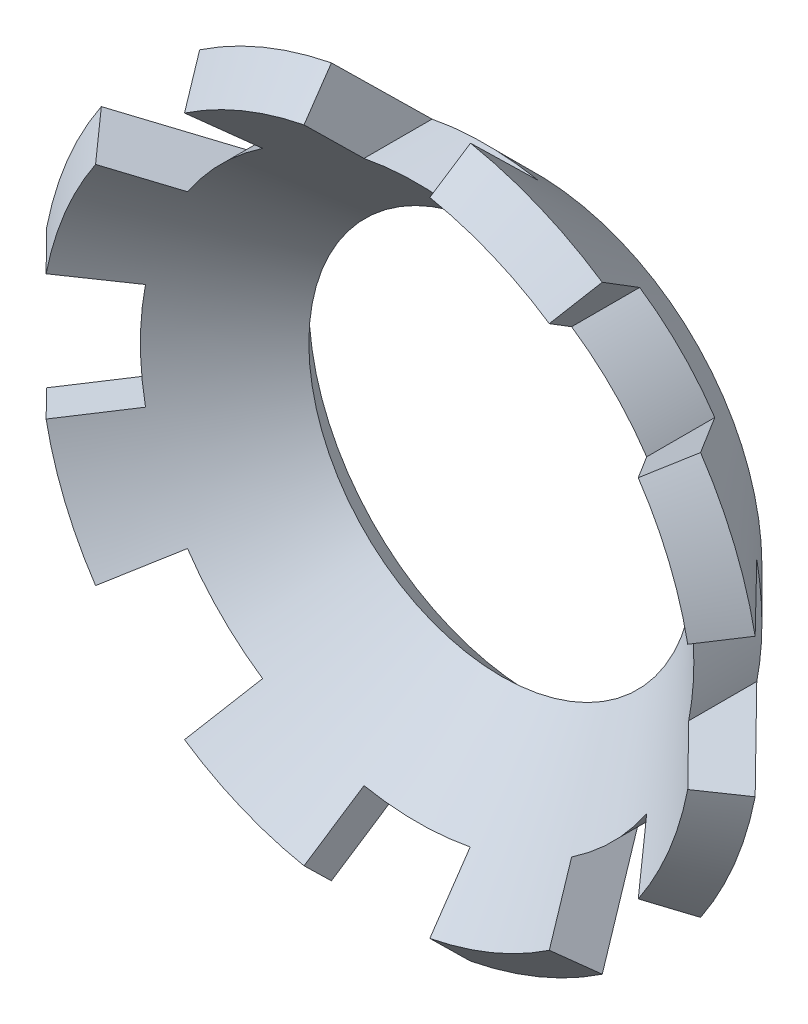
from build123d import *

# Parameters (mm, degrees)
TOOTHCUT_DEPTH = 5.387258871
TOOTHPAT_COUNT = 8


with BuildPart() as part:
    # BodySke → BaseBody (revolve)
    with BuildSketch(Plane(origin=(0, 0, 0), x_dir=(1, 0, 0), z_dir=(0, 1, 0))):
        Polygon((3, 0), (1.882842712, 1.117157288), (1.6, 0.834314575), (2.717157288, -0.282842712), align=None)
    revolve(axis=Axis((0, 0, 1.599979551), (0, 0, -1)))

    # ToothSke → ToothCut (cut, symmetric)
    with BuildSketch(Plane.XY):
        with BuildLine():
            Line((2.257265148, 0.441309475), (3, 0.589048623))
            Line((3, 0.589048623), (3, -0.589048623))
            Line((3, -0.589048623), (2.257265148, -0.441309475))
            ThreePointArc((2.257265148, -0.441309475), (2.3, 0), (2.257265148, 0.441309475))
        make_face()
    toothcut = extrude(amount=TOOTHCUT_DEPTH, both=True, mode=Mode.SUBTRACT)

    # ToothPat: ToothCut ×8 about axis
    toothpat_axis = Axis((0, 0, 1.599979551), (0, 0, -1))
    for i in range(1, TOOTHPAT_COUNT):
        add(toothcut.rotate(toothpat_axis, i * 360 / TOOTHPAT_COUNT), mode=Mode.SUBTRACT)


solid = part.part
